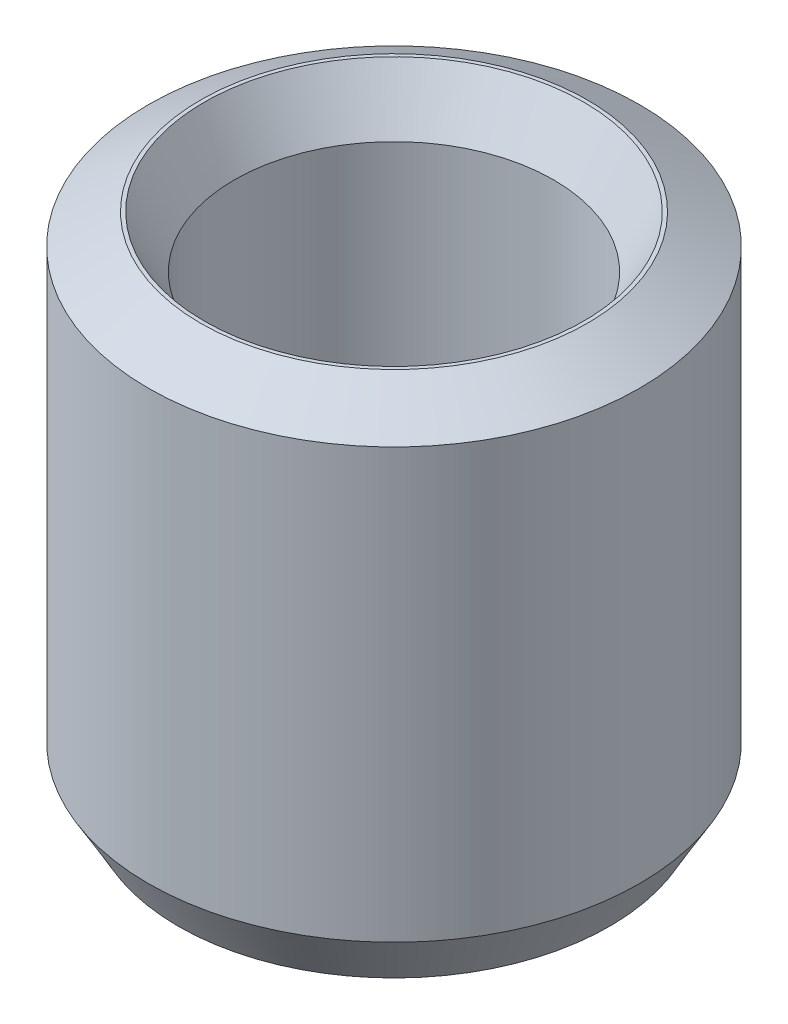
from build123d import *
from OCP.BRepFilletAPI import BRepFilletAPI_MakeChamfer

# Parameters (mm, degrees)
SKETCH1_R           = 7.5
BOSS_EXTRUDE1_DEPTH = 15.612462688
SKETCH2_R           = 4.872198727
CUT_EXTRUDE1_DEPTH  = 19.874559364
CHAMFER1_SIZE       = 0.920473024
CHAMFER1_SIZE2      = 1.594306044


with BuildPart() as part:
    # Sketch1 → Boss-Extrude1 (new body)
    with BuildSketch(Plane(origin=(0, 0, 0), x_dir=(1, 0, 0), z_dir=(0, 1, 0))):
        Circle(SKETCH1_R)
    extrude(amount=BOSS_EXTRUDE1_DEPTH)

    # Sketch2 → Cut-Extrude1 (cut, through all)
    with BuildSketch(Plane(origin=(0, 0, 0), x_dir=(1, 0, 0), z_dir=(0, 1, 0))):
        Circle(SKETCH2_R)
    extrude(amount=CUT_EXTRUDE1_DEPTH, mode=Mode.SUBTRACT)

    # Chamfer1: one chamfer whose edges measure the first distance from different faces: ONE call of the kernel's chamfer builder (chamfer() names one face for all edges)
    chamfer1_edges_1 = [part.edges().sort_by_distance(p)[0] for p in [
        (-4.872198727, 15.612462688, 0),
    ]]
    chamfer1_side_1 = [part.faces().sort_by_distance(p)[0] for p in [
        (-7.287867966, 15.612462688, 0),
    ]]
    chamfer1_edges_2 = [part.edges().sort_by_distance(p)[0] for p in [
        (-4.872198727, 0, 0),
    ]]
    chamfer1_side_2 = [part.faces().sort_by_distance(p)[0] for p in [
        (-4.872198727, 7.806231344, 0),
    ]]
    chamfer1_edges_3 = [part.edges().sort_by_distance(p)[0] for p in [
        (-7.5, 0, 0),
    ]]
    chamfer1_side_3 = [part.faces().sort_by_distance(p)[0] for p in [
        (-7.287867966, 0, 0),
    ]]
    chamfer1_edges_4 = [part.edges().sort_by_distance(p)[0] for p in [
        (-7.5, 15.612462688, 0),
    ]]
    chamfer1_side_4 = [part.faces().sort_by_distance(p)[0] for p in [
        (-7.5, 7.806231344, 0),
    ]]
    chamfer1 = BRepFilletAPI_MakeChamfer(part.part.solid().wrapped)
    for e in chamfer1_edges_1:
        chamfer1.Add(CHAMFER1_SIZE, CHAMFER1_SIZE2, e.wrapped, chamfer1_side_1[0].wrapped)  # the first distance lies on this face
    for e in chamfer1_edges_2:
        chamfer1.Add(CHAMFER1_SIZE, CHAMFER1_SIZE2, e.wrapped, chamfer1_side_2[0].wrapped)  # the first distance lies on this face
    for e in chamfer1_edges_3:
        chamfer1.Add(CHAMFER1_SIZE, CHAMFER1_SIZE2, e.wrapped, chamfer1_side_3[0].wrapped)  # the first distance lies on this face
    for e in chamfer1_edges_4:
        chamfer1.Add(CHAMFER1_SIZE, CHAMFER1_SIZE2, e.wrapped, chamfer1_side_4[0].wrapped)  # the first distance lies on this face
    add(Compound.cast(chamfer1.Shape()), mode=Mode.REPLACE)


solid = part.part
